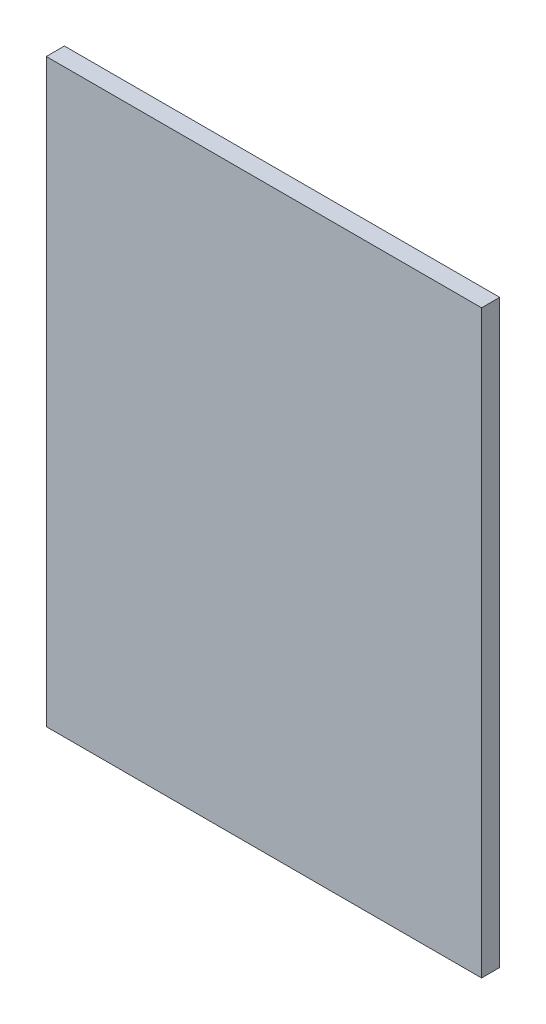
from build123d import *

# Parameters (mm, degrees)
SKETCH1_W           = 60
SKETCH1_H           = 80
BOSS_EXTRUDE1_DEPTH = 2.5


with BuildPart() as part:
    # Sketch1 → Boss-Extrude1 (new body)
    with BuildSketch(Plane.XY):
        Rectangle(SKETCH1_W, SKETCH1_H)
    extrude(amount=BOSS_EXTRUDE1_DEPTH)


solid = part.part
